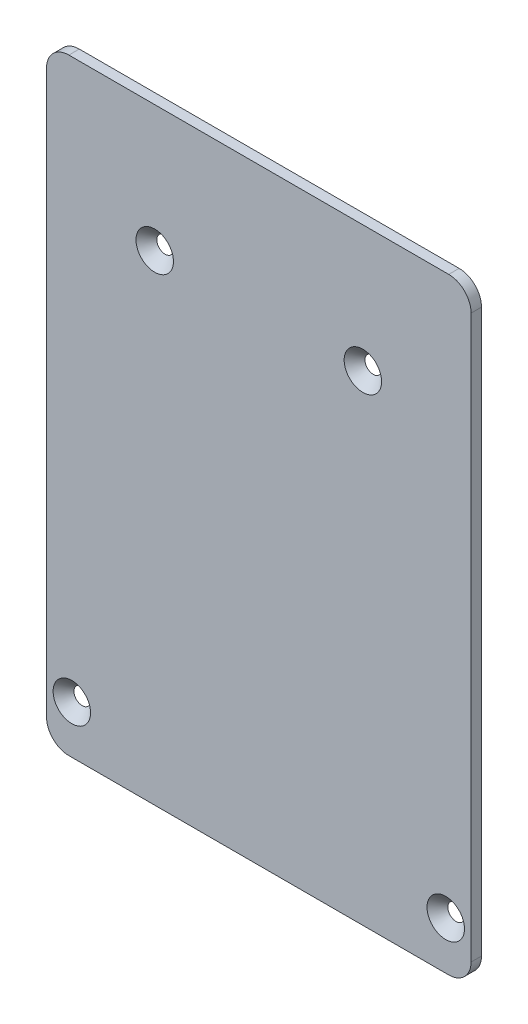
from build123d import *

# Parameters (mm, degrees)
ESQUISSE1_R        = 1.6
BOSS_EXTRU_1_DEPTH = 2
CHANFREIN1_SIZE    = 2


with BuildPart() as part:
    # Esquisse1 → Boss.-Extru.1 (new body)
    with BuildSketch(Plane.XY):
        with BuildLine():
            Line((-36.5, -58.3), (36.5, -58.3))
            ThreePointArc((36.5, -58.3), (39.540559159, -57.040559159), (40.8, -54))
            Line((40.8, -54), (40.8, 54))
            ThreePointArc((40.8, 54), (39.540559159, 57.040559159), (36.5, 58.3))
            Line((36.5, 58.3), (-36.5, 58.3))
            ThreePointArc((-36.5, 58.3), (-39.540559159, 57.040559159), (-40.8, 54))
            Line((-40.8, 54), (-40.8, -54))
            ThreePointArc((-40.8, -54), (-39.540559159, -57.040559159), (-36.5, -58.3))
        make_face()
        with Locations((35.93, -49.1)):
            Circle(ESQUISSE1_R, mode=Mode.SUBTRACT)
        with Locations((-35.93, -49.1)):
            Circle(ESQUISSE1_R, mode=Mode.SUBTRACT)
        with Locations((-20, 34)):
            Circle(ESQUISSE1_R, mode=Mode.SUBTRACT)
        with Locations((20, 34)):
            Circle(ESQUISSE1_R, mode=Mode.SUBTRACT)
    extrude(amount=-BOSS_EXTRU_1_DEPTH)

    # Chanfrein1
    chanfrein1_edges = [part.edges().sort_by_distance(p)[0] for p in [
        (34.33, -49.1, 0),
        (-37.53, -49.1, 0),
        (-21.6, 34, 0),
        (18.4, 34, 0),
    ]]
    chamfer(chanfrein1_edges, length=CHANFREIN1_SIZE - 0.0001)  # a hair under: the kernel refuses the full size


solid = part.part
